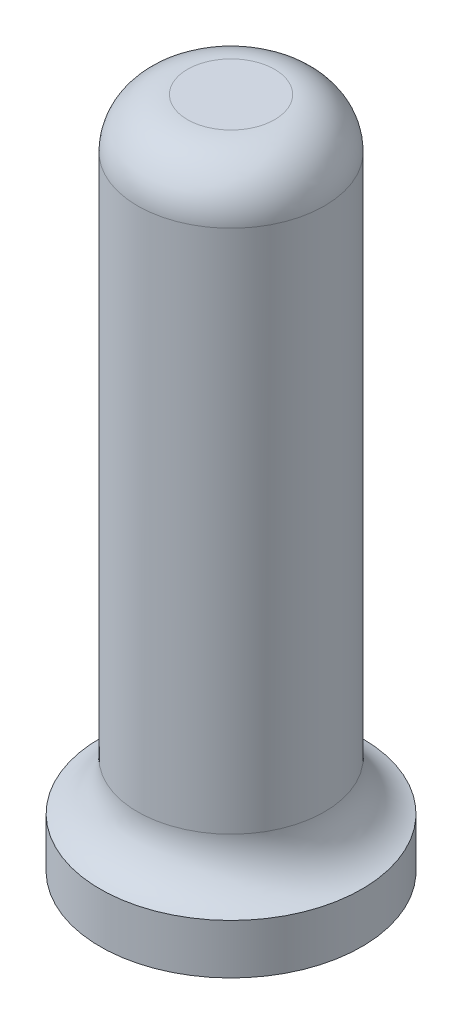
from build123d import *

# Parameters (mm, degrees)
SKETCH1_R           = 3.75
BOSS_EXTRUDE1_DEPTH = 25
FILLET1_R           = 2
SKETCH2_R           = 5.25
BOSS_EXTRUDE2_DEPTH = 2
FILLET2_R           = 2


with BuildPart() as part:
    # Sketch1 → Boss-Extrude1 (new body)
    with BuildSketch(Plane(origin=(0, 0, 0), x_dir=(1, 0, 0), z_dir=(0, 1, 0))):
        with Locations(Location((0, 0, 0), (0, 0, 270))):
            Circle(SKETCH1_R)
    extrude(amount=BOSS_EXTRUDE1_DEPTH)

    # Fillet1
    fillet1_edges = [part.edges().sort_by_distance(p)[0] for p in [
        (0, 25, -3.75),
    ]]
    fillet(fillet1_edges, radius=FILLET1_R)

    # Sketch2 → Boss-Extrude2 (add)
    with BuildSketch(Plane.XZ):
        with Locations(Location((0, 0, 0), (0, 0, 270))):
            Circle(SKETCH2_R)
    extrude(amount=BOSS_EXTRUDE2_DEPTH)

    # Fillet2
    # the kernel refuses this fillet: 2 mm, written as the material it adds along each edge
    with BuildSketch(Plane(origin=(0, 0, 0), x_dir=(0, 0, 1), z_dir=(-1, 0, 0))) as fillet2_piece_1:
        with BuildLine():
            CenterArc((5.75, 1.936491673), FILLET2_R, 180, 75.522487814)
            Line((3.75, 1.936491673), (3.71, 1.936491673))
            Line((3.71, 1.936491673), (3.71, 0))
            Line((3.71, 0), (3.75, -0.04))
            ThreePointArc((3.75, -0.04), (4.5, -0.04), (5.24, -0.038729833))
            Line((5.24, -0.038729833), (5.25, 0))
        make_face()
    revolve(axis=Axis((0, 0, 0), (0, 1, 0)))


solid = part.part
